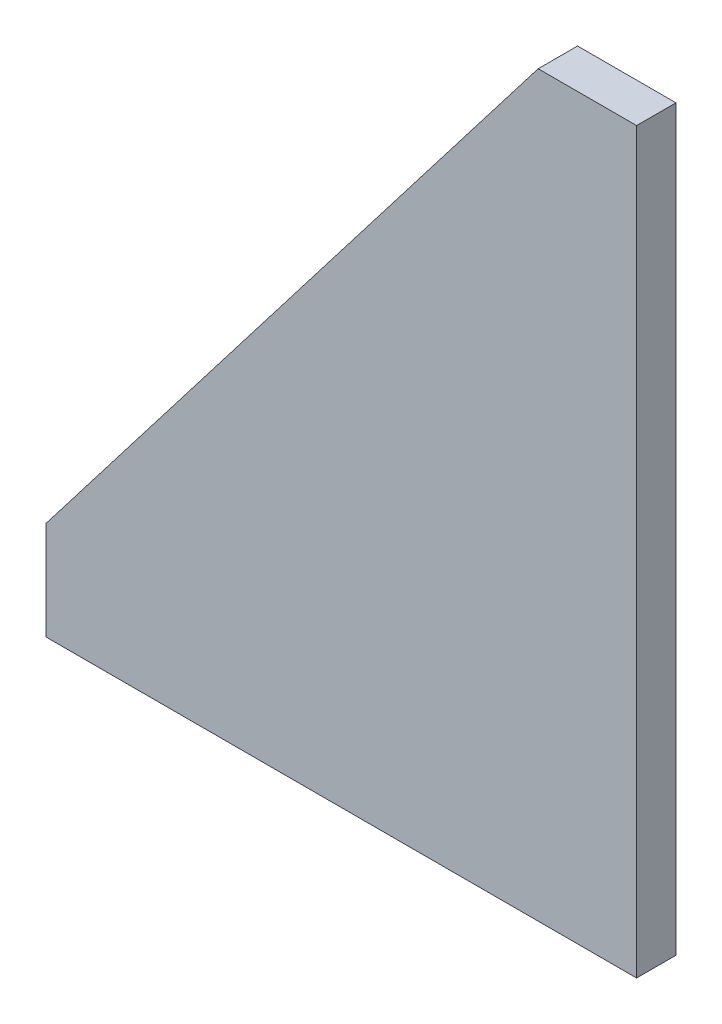
from build123d import *

# Parameters (mm, degrees)
SM_BASE_FLANGE_1_DEPTH = 8


# Sheet-metal steps are written as plain solids
with BuildPart() as part:
    # Sketch 1 → Базовая кромка1 (new body)
    with BuildSketch(Plane.XY):
        Polygon((100, 150), (0, 20), (0, 0), (120, 0), (120, 150), align=None)
    extrude(amount=-SM_BASE_FLANGE_1_DEPTH)


solid = part.part
